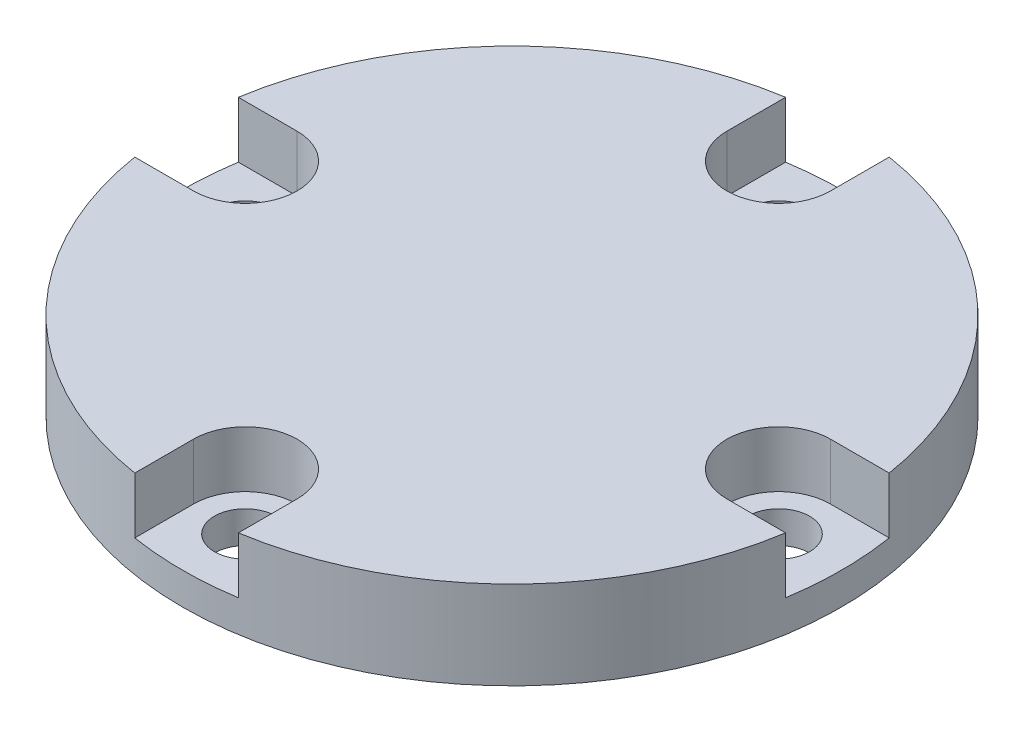
from build123d import *

# Parameters (mm, degrees)
SKETCH1_R           = 14.95
BOSS_EXTRUDE1_DEPTH = 4
CUT_EXTRUDE1_START  = -2.55
CUT_EXTRUDE1_DEPTH  = 2.55
SKETCH3_R           = 1.4
CUT_EXTRUDE2_DEPTH  = 2.55


with BuildPart() as part:
    # Sketch1 → Boss-Extrude1 (new body)
    with BuildSketch(Plane(origin=(0, 0, 0), x_dir=(1, 0, 0), z_dir=(0, 1, 0))):
        Circle(SKETCH1_R)
    extrude(amount=BOSS_EXTRUDE1_DEPTH)

    # Sketch2 → Cut-Extrude1 (cut)
    with BuildSketch(Plane(origin=(0, 4, 0), x_dir=(1, 0, 0), z_dir=(0, 1, 0)).offset(CUT_EXTRUDE1_START)):
        with BuildLine():
            Line((-2.35, 12.1), (-2.35, 14.764145759))
            ThreePointArc((-2.35, 14.764145759), (0, 14.95), (2.35, 14.764145759))
            Line((2.35, 14.764145759), (2.35, 12.1))
            ThreePointArc((2.35, 12.1), (0, 9.75), (-2.35, 12.1))
        make_face()
        with BuildLine():
            Line((12.1, -2.35), (14.764145759, -2.35))
            ThreePointArc((14.764145759, -2.35), (14.95, 0), (14.764145759, 2.35))
            Line((14.764145759, 2.35), (12.1, 2.35))
            ThreePointArc((12.1, 2.35), (9.75, 0), (12.1, -2.35))
        make_face()
        with BuildLine():
            Line((-2.35, -12.1), (-2.35, -14.764145759))
            ThreePointArc((-2.35, -14.764145759), (0, -14.95), (2.35, -14.764145759))
            Line((2.35, -14.764145759), (2.35, -12.1))
            ThreePointArc((2.35, -12.1), (0, -9.75), (-2.35, -12.1))
        make_face()
        with BuildLine():
            Line((-12.1, 2.35), (-14.764145759, 2.35))
            ThreePointArc((-14.764145759, 2.35), (-14.95, 0), (-14.764145759, -2.35))
            Line((-14.764145759, -2.35), (-12.1, -2.35))
            ThreePointArc((-12.1, -2.35), (-9.75, 0), (-12.1, 2.35))
        make_face()
    extrude(amount=CUT_EXTRUDE1_DEPTH, mode=Mode.SUBTRACT)

    # Sketch3 → Cut-Extrude2 (cut)
    with BuildSketch(Plane(origin=(0, 1.45, 0), x_dir=(1, 0, 0), z_dir=(0, 1, 0))):
        with Locations((0, 12.1)):
            Circle(SKETCH3_R)
        with Locations((-12.1, 0)):
            Circle(SKETCH3_R)
        with Locations((0, -12.1)):
            Circle(SKETCH3_R)
        with Locations((12.1, 0)):
            Circle(SKETCH3_R)
    extrude(amount=-CUT_EXTRUDE2_DEPTH, mode=Mode.SUBTRACT)


solid = part.part
